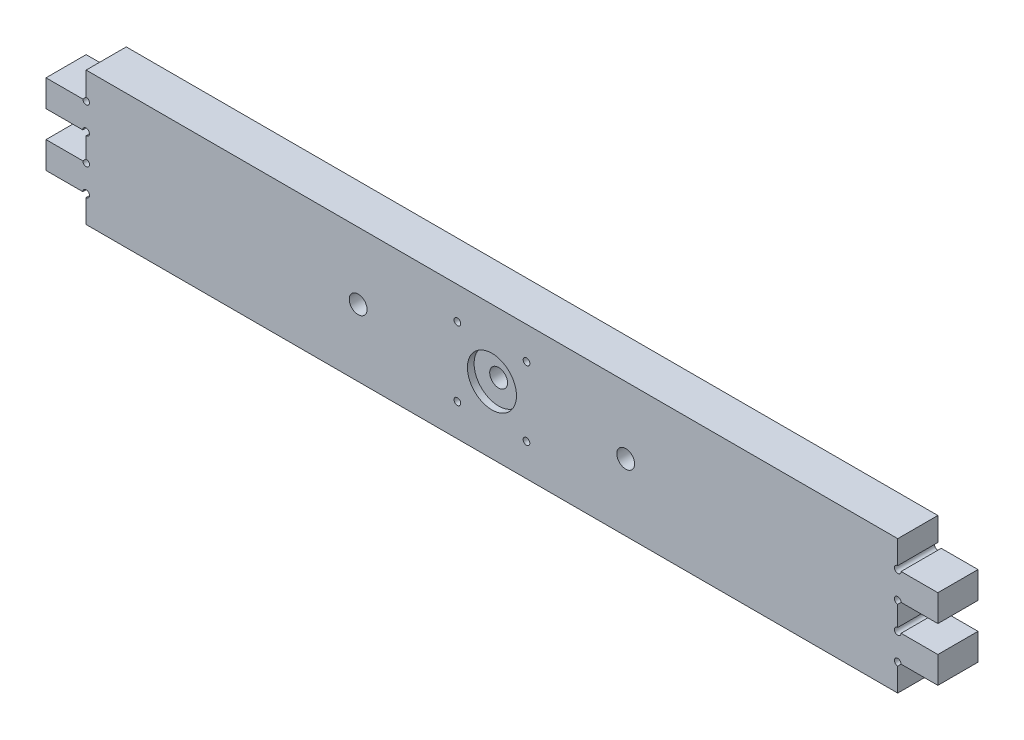
from build123d import *

# Parameters (mm, degrees)
SKETCH1_R           = 4
BOSS_EXTRUDE1_DEPTH = 18
CUT_EXTRUDE1_REACH  = 205.037
SKETCH2_R           = 1.5
SKETCH3_R           = 11
CUT_EXTRUDE2_DEPTH  = 3


with BuildPart() as part:
    # Sketch1 → Boss-Extrude1 (new body)
    with BuildSketch(Plane.XY):
        with BuildLine():
            Line((-182, -19.5), (-182, -30))
            Line((-182, -30), (182, -30))
            Line((182, -30), (182, -19.5))
            ThreePointArc((182, -19.5), (180.939339828, -16.939339828), (183.5, -18))
            Line((183.5, -18), (200, -18))
            Line((200, -18), (200, -6))
            Line((200, -6), (183.5, -6))
            ThreePointArc((183.5, -6), (180.939339828, -7.060660172), (182, -4.5))
            Line((182, -4.5), (182, 4.5))
            ThreePointArc((182, 4.5), (180.939339828, 7.060660172), (183.5, 6))
            Line((183.5, 6), (200, 6))
            Line((200, 6), (200, 18))
            Line((200, 18), (183.5, 18))
            ThreePointArc((183.5, 18), (180.939339828, 16.939339828), (182, 19.5))
            Line((182, 19.5), (182, 30))
            Line((182, 30), (-182, 30))
            Line((-182, 30), (-182, 19.5))
            ThreePointArc((-182, 19.5), (-180.939339828, 16.939339828), (-183.5, 18))
            Line((-183.5, 18), (-200, 18))
            Line((-200, 18), (-200, 6))
            Line((-200, 6), (-183.5, 6))
            ThreePointArc((-183.5, 6), (-180.939339828, 7.060660172), (-182, 4.5))
            Line((-182, 4.5), (-182, -4.5))
            ThreePointArc((-182, -4.5), (-180.939339828, -7.060660172), (-183.5, -6))
            Line((-183.5, -6), (-200, -6))
            Line((-200, -6), (-200, -18))
            Line((-200, -18), (-183.5, -18))
            ThreePointArc((-183.5, -18), (-180.939339828, -16.939339828), (-182, -19.5))
        make_face()
        with Locations((-60, 0)):
            Circle(SKETCH1_R, mode=Mode.SUBTRACT)
        Circle(SKETCH1_R, mode=Mode.SUBTRACT)
        with Locations((60, 0)):
            Circle(SKETCH1_R, mode=Mode.SUBTRACT)
    extrude(amount=BOSS_EXTRUDE1_DEPTH)

    # Sketch2 → Cut-Extrude1 (cut, up to next)
    with BuildSketch(Plane.XY.offset(18), mode=Mode.PRIVATE) as cut_extrude1_sk1:
        with Locations((15.495, 15.495)):
            Circle(SKETCH2_R)
    cut_extrude1_tool1 = extrude(cut_extrude1_sk1.sketch, amount=-CUT_EXTRUDE1_REACH, mode=Mode.PRIVATE) & part.part
    # Sketch2 → Cut-Extrude1 (cut, up to next)
    with BuildSketch(Plane.XY.offset(18), mode=Mode.PRIVATE) as cut_extrude1_sk2:
        with Locations((-15.495, 15.495)):
            Circle(SKETCH2_R)
    cut_extrude1_tool2 = extrude(cut_extrude1_sk2.sketch, amount=-CUT_EXTRUDE1_REACH, mode=Mode.PRIVATE) & part.part
    # Sketch2 → Cut-Extrude1 (cut, up to next)
    with BuildSketch(Plane.XY.offset(18), mode=Mode.PRIVATE) as cut_extrude1_sk3:
        with Locations((15.495, -15.495)):
            Circle(SKETCH2_R)
    cut_extrude1_tool3 = extrude(cut_extrude1_sk3.sketch, amount=-CUT_EXTRUDE1_REACH, mode=Mode.PRIVATE) & part.part
    # Sketch2 → Cut-Extrude1 (cut, up to next)
    with BuildSketch(Plane.XY.offset(18), mode=Mode.PRIVATE) as cut_extrude1_sk4:
        with Locations((-15.495, -15.495)):
            Circle(SKETCH2_R)
    cut_extrude1_tool4 = extrude(cut_extrude1_sk4.sketch, amount=-CUT_EXTRUDE1_REACH, mode=Mode.PRIVATE) & part.part
    add(cut_extrude1_tool1.solids().sort_by_distance((15.495, 15.495, 18))[0], mode=Mode.SUBTRACT)
    add(cut_extrude1_tool2.solids().sort_by_distance((-15.495, 15.495, 18))[0], mode=Mode.SUBTRACT)
    add(cut_extrude1_tool3.solids().sort_by_distance((15.495, -15.495, 18))[0], mode=Mode.SUBTRACT)
    add(cut_extrude1_tool4.solids().sort_by_distance((-15.495, -15.495, 18))[0], mode=Mode.SUBTRACT)

    # Sketch3 → Cut-Extrude2 (cut)
    with BuildSketch(Plane.XY.offset(18)):
        Circle(SKETCH3_R)
    extrude(amount=-CUT_EXTRUDE2_DEPTH, mode=Mode.SUBTRACT)


solid = part.part
